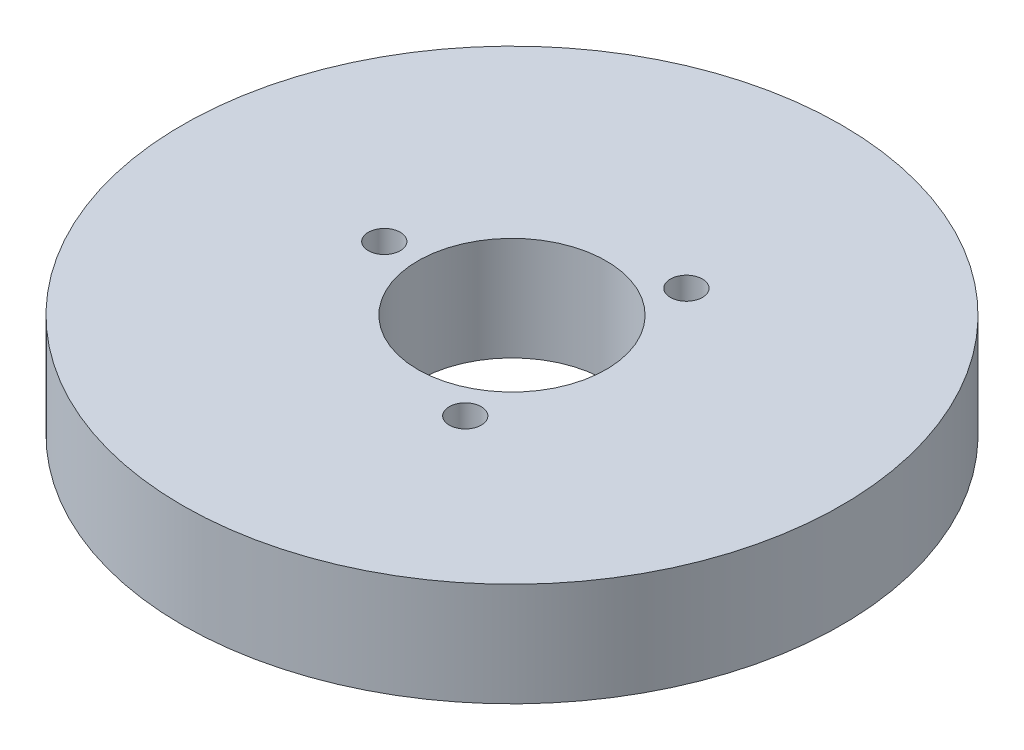
from build123d import *

# Parameters (mm, degrees)
SKETCH1_R           = 70
BOSS_EXTRUDE1_DEPTH = 22
SKETCH2_R           = 20
CUT_EXTRUDE1_DEPTH  = 102.410058673
SKETCH3_R           = 3.39997832
CUT_EXTRUDE2_DEPTH  = 17.603015952
CIRPATTERN1_COUNT   = 3


with BuildPart() as part:
    # Sketch1 → Boss-Extrude1 (new body)
    with BuildSketch(Plane(origin=(0, 0, 0), x_dir=(1, 0, 0), z_dir=(0, 1, 0))):
        Circle(SKETCH1_R)
    extrude(amount=BOSS_EXTRUDE1_DEPTH)

    # Sketch2 → Cut-Extrude1 (cut, through all)
    with BuildSketch(Plane(origin=(0, 0, 0), x_dir=(1, 0, 0), z_dir=(0, 1, 0))):
        Circle(SKETCH2_R)
    extrude(amount=CUT_EXTRUDE1_DEPTH, mode=Mode.SUBTRACT)

    # Sketch3 → Cut-Extrude2 (cut)
    with BuildSketch(Plane(origin=(0, 22, 0), x_dir=(1, 0, 0), z_dir=(0, 1, 0))):
        with Locations((-27.121283171, 0)):
            Circle(SKETCH3_R)
    cut_extrude2 = extrude(amount=-CUT_EXTRUDE2_DEPTH, mode=Mode.SUBTRACT)

    # CirPattern1: Cut-Extrude2 ×3 about axis
    cirpattern1_axis = Axis((0, 0, 0), (0, 1, 0))
    for i in range(1, CIRPATTERN1_COUNT):
        add(cut_extrude2.rotate(cirpattern1_axis, i * 360 / CIRPATTERN1_COUNT), mode=Mode.SUBTRACT)


solid = part.part
